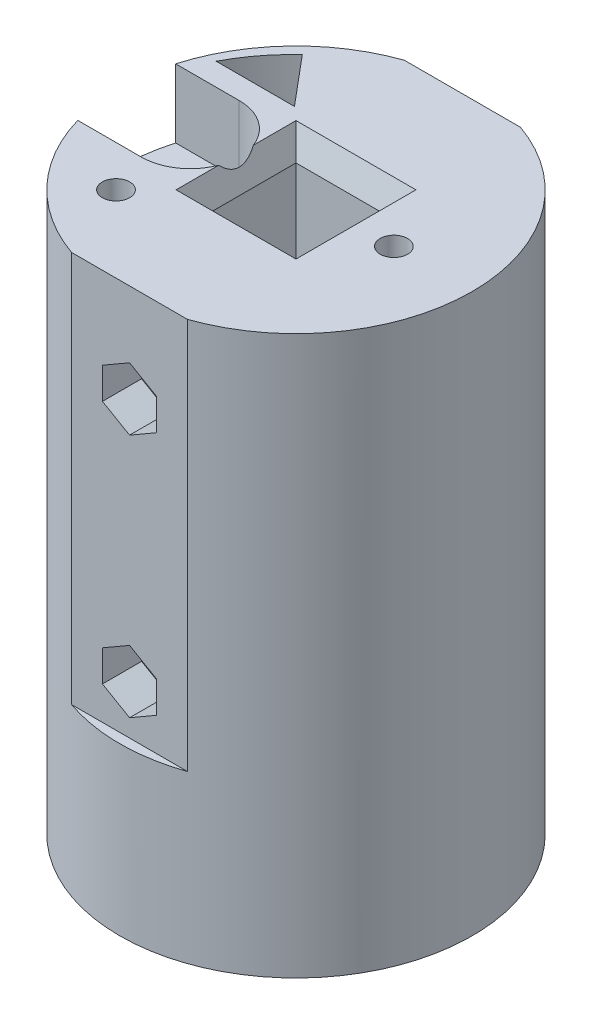
from build123d import *

# Parameters (mm, degrees)
SKETCH1_R           = 18
SKETCH1_R_2         = 2
SKETCH1_W           = 10.25
SKETCH1_H           = 10.25
BOSS_EXTRUDE1_DEPTH = 57
CUT_EXTRUDE1_START  = -7
CUT_EXTRUDE1_DEPTH  = 7
SKETCH4_W           = 9.35
SKETCH4_H           = 9.35
CUT_EXTRUDE3_DEPTH  = 20.4
CUT_EXTRUDE4_START  = -40
CUT_EXTRUDE4_DEPTH  = 40
SKETCH6_R           = 1.5
CUT_EXTRUDE5_DEPTH  = 70.267597042
SKETCH7_R           = 3
CUT_EXTRUDE6_DEPTH  = 3
CUT_EXTRUDE7_DEPTH  = 4
CHAMFER1_SIZE       = 1
CHAMFER1_SIZE_2     = 2.747477419
CUT_EXTRUDE8_DEPTH  = 63.42595614
SKETCH12_R          = 1.4
CUT_EXTRUDE10_DEPTH = 20


with BuildPart() as part:
    # Sketch1 → Boss-Extrude1 (new body)
    with BuildSketch(Plane(origin=(0, 0, 0), x_dir=(1, 0, 0), z_dir=(0, 1, 0))):
        with Locations(Location((0, 0, 0), (0, 0, 90))):
            Circle(SKETCH1_R)
        with Locations(Location((-12, 0, 0), (0, 0, 90))):
            Circle(SKETCH1_R_2, mode=Mode.SUBTRACT)
        Rectangle(SKETCH1_W, SKETCH1_H, mode=Mode.SUBTRACT)
    extrude(amount=BOSS_EXTRUDE1_DEPTH)

    # Sketch2 → Cut-Extrude1 (cut)
    with BuildSketch(Plane(origin=(0, 57, 0), x_dir=(1, 0, 0), z_dir=(0, 1, 0)).offset(CUT_EXTRUDE1_START)):
        with BuildLine():
            Line((-10.8, 5), (-17.291616466, 5))
            ThreePointArc((-17.291616466, 5), (-18, 0), (-17.291616466, -5))
            Line((-17.291616466, -5), (-10.8, -5))
            ThreePointArc((-10.8, -5), (-5.8, 0), (-10.8, 5))
        make_face()
    extrude(amount=CUT_EXTRUDE1_DEPTH, mode=Mode.SUBTRACT)

    # Sketch4 → Cut-Extrude3 (cut)
    with BuildSketch(Plane(origin=(0, 0, 0), x_dir=(-1, 0, 0), z_dir=(0, -1, 0))):
        with Locations((11.135393506, 0.872889968)):
            Rectangle(SKETCH4_W, SKETCH4_H)
    extrude(amount=-CUT_EXTRUDE3_DEPTH, mode=Mode.SUBTRACT)

    # Sketch5 → Cut-Extrude4 (cut)
    with BuildSketch(Plane(origin=(0, 57, 0), x_dir=(1, 0, 0), z_dir=(0, 1, 0)).offset(CUT_EXTRUDE4_START)):
        with BuildLine():
            Line((5.916079783, 17), (-5.916079783, 17))
            ThreePointArc((-5.916079783, 17), (0, 18), (5.916079783, 17))
        make_face()
        with BuildLine():
            Line((5.916079783, -17), (-5.916079783, -17))
            ThreePointArc((-5.916079783, -17), (0, -18), (5.916079783, -17))
        make_face()
    extrude(amount=CUT_EXTRUDE4_DEPTH, mode=Mode.SUBTRACT)

    # Sketch6 → Cut-Extrude5 (cut, through all)
    with BuildSketch(Plane(origin=(0, 0, -17), x_dir=(-1, 0, 0), z_dir=(0, 0, -1))):
        with Locations((0, 47)):
            Circle(SKETCH6_R)
        with Locations((0, 22)):
            Circle(SKETCH6_R)
    extrude(amount=-CUT_EXTRUDE5_DEPTH, mode=Mode.SUBTRACT)

    # Sketch7 → Cut-Extrude6 (cut)
    with BuildSketch(Plane(origin=(0, 0, -17), x_dir=(-1, 0, 0), z_dir=(0, 0, -1))):
        with Locations((0, 47)):
            Circle(SKETCH7_R)
        with Locations((0, 22)):
            Circle(SKETCH7_R)
    extrude(amount=-CUT_EXTRUDE6_DEPTH, mode=Mode.SUBTRACT)

    # Sketch8 → Cut-Extrude7 (cut)
    with BuildSketch(Plane.XY.offset(17)):
        Polygon((0, 43.8), (2.771281292, 45.4), (2.771281292, 48.6), (0, 50.2), (-2.771281292, 48.6), (-2.771281292, 45.4), align=None)
        Polygon((0, 18.8), (2.771281292, 20.4), (2.771281292, 23.6), (0, 25.2), (-2.771281292, 23.6), (-2.771281292, 20.4), align=None)
    extrude(amount=-CUT_EXTRUDE7_DEPTH, mode=Mode.SUBTRACT)

    # Chamfer1
    # the kernel refuses this chamfer: 2.747477419, 1 mm, written as the material it takes off along each edge
    with BuildSketch(Plane(origin=(-5.125, 57, -5.125), x_dir=(0, 0.09904090225204956, -0.9950833631817488), z_dir=(1, 0, 0)), Plane(origin=(-5.125, 57, 5.125), x_dir=(-0.9950833631817488, 0.09904090225204956, 0), z_dir=(0, 0, -1)), Plane(origin=(5.125, 57, 5.125), x_dir=(0, 0.09904090225204956, 0.9950833631817488), z_dir=(-1, 0, 0)), Plane(origin=(5.125, 57, -5.125), x_dir=(0.9950833631817488, 0.09904090225204956, 0), z_dir=(0, 0, 1))) as chamfer1_piece_1:
        Polygon((CHAMFER1_SIZE * 0.995083363182, -CHAMFER1_SIZE * 0.099040902252), (-CHAMFER1_SIZE_2 * 0.0990409022684, -CHAMFER1_SIZE_2 * 0.995083363346), (0, 0), align=None)
    extrude(amount=10.25, mode=Mode.SUBTRACT)
    with BuildSketch(Plane(origin=(-5.125, 57, 5.125), x_dir=(-0.9950833631817488, 0.09904090225204956, 0), z_dir=(0, 0, -1))) as chamfer1_piece_2a_section:
        Polygon((CHAMFER1_SIZE * 0.995083363182, -CHAMFER1_SIZE * 0.099040902252), (-CHAMFER1_SIZE_2 * 0.0990409022684, -CHAMFER1_SIZE_2 * 0.995083363346), (0, 0), align=None)
    chamfer1_piece_2a = extrude(amount=17.377491449, mode=Mode.PRIVATE)
    chamfer1_piece_2a = split(chamfer1_piece_2a, bisect_by=Plane(origin=(-5.432505006, 56.059901151, -5.125), z_dir=(0, 0, -1)), keep=Keep.TOP, mode=Mode.PRIVATE)
    with BuildSketch(Plane(origin=(-12.252491449, 57, -5.125), x_dir=(0, 0.09904090225204956, -0.9950833631817488), z_dir=(1, 0, 0))) as chamfer1_piece_2b_section:
        Polygon((CHAMFER1_SIZE * 0.995083363182, -CHAMFER1_SIZE * 0.099040902252), (-CHAMFER1_SIZE_2 * 0.0990409022684, -CHAMFER1_SIZE_2 * 0.995083363346), (0, 0), align=None)
    chamfer1_piece_2b = extrude(amount=17.377491449, mode=Mode.PRIVATE)
    chamfer1_piece_2b = split(chamfer1_piece_2b, bisect_by=Plane(origin=(-5.125, 56.059901151, -5.432505006), z_dir=(-1, 0, 0)), keep=Keep.TOP, mode=Mode.PRIVATE)
    chamfer1_piece_2 = chamfer1_piece_2a & chamfer1_piece_2b
    add(chamfer1_piece_2, mode=Mode.SUBTRACT)
    with BuildSketch(Plane(origin=(5.125, 57, -12.252491449), x_dir=(0.9950833631817488, 0.09904090225204956, 0), z_dir=(0, 0, 1))) as chamfer1_piece_3a_section:
        Polygon((CHAMFER1_SIZE * 0.995083363182, -CHAMFER1_SIZE * 0.099040902252), (-CHAMFER1_SIZE_2 * 0.0990409022684, -CHAMFER1_SIZE_2 * 0.995083363346), (0, 0), align=None)
    chamfer1_piece_3a = extrude(amount=17.377491449, mode=Mode.PRIVATE)
    chamfer1_piece_3a = split(chamfer1_piece_3a, bisect_by=Plane(origin=(5.432505006, 56.059901151, -5.125), z_dir=(0, 0, -1)), keep=Keep.TOP, mode=Mode.PRIVATE)
    with BuildSketch(Plane(origin=(-5.125, 57, -5.125), x_dir=(0, 0.09904090225204956, -0.9950833631817488), z_dir=(1, 0, 0))) as chamfer1_piece_3b_section:
        Polygon((CHAMFER1_SIZE * 0.995083363182, -CHAMFER1_SIZE * 0.099040902252), (-CHAMFER1_SIZE_2 * 0.0990409022684, -CHAMFER1_SIZE_2 * 0.995083363346), (0, 0), align=None)
    chamfer1_piece_3b = extrude(amount=17.377491449, mode=Mode.PRIVATE)
    chamfer1_piece_3b = split(chamfer1_piece_3b, bisect_by=Plane(origin=(5.125, 56.059901151, -5.432505006), z_dir=(1, 0, 0)), keep=Keep.TOP, mode=Mode.PRIVATE)
    chamfer1_piece_3 = chamfer1_piece_3a & chamfer1_piece_3b
    add(chamfer1_piece_3, mode=Mode.SUBTRACT)
    with BuildSketch(Plane(origin=(5.125, 57, 5.125), x_dir=(0, 0.09904090225204956, 0.9950833631817488), z_dir=(-1, 0, 0))) as chamfer1_piece_4a_section:
        Polygon((CHAMFER1_SIZE * 0.995083363182, -CHAMFER1_SIZE * 0.099040902252), (-CHAMFER1_SIZE_2 * 0.0990409022684, -CHAMFER1_SIZE_2 * 0.995083363346), (0, 0), align=None)
    chamfer1_piece_4a = extrude(amount=17.377491449, mode=Mode.PRIVATE)
    chamfer1_piece_4a = split(chamfer1_piece_4a, bisect_by=Plane(origin=(-5.125, 56.059901151, 5.432505006), z_dir=(-1, 0, 0)), keep=Keep.TOP, mode=Mode.PRIVATE)
    with BuildSketch(Plane(origin=(-5.125, 57, 12.252491449), x_dir=(-0.9950833631817488, 0.09904090225204956, 0), z_dir=(0, 0, -1))) as chamfer1_piece_4b_section:
        Polygon((CHAMFER1_SIZE * 0.995083363182, -CHAMFER1_SIZE * 0.099040902252), (-CHAMFER1_SIZE_2 * 0.0990409022684, -CHAMFER1_SIZE_2 * 0.995083363346), (0, 0), align=None)
    chamfer1_piece_4b = extrude(amount=17.377491449, mode=Mode.PRIVATE)
    chamfer1_piece_4b = split(chamfer1_piece_4b, bisect_by=Plane(origin=(-5.432505006, 56.059901151, 5.125), z_dir=(0, 0, 1)), keep=Keep.TOP, mode=Mode.PRIVATE)
    chamfer1_piece_4 = chamfer1_piece_4a & chamfer1_piece_4b
    add(chamfer1_piece_4, mode=Mode.SUBTRACT)
    with BuildSketch(Plane(origin=(12.252491449, 57, 5.125), x_dir=(0, 0.09904090225204956, 0.9950833631817488), z_dir=(-1, 0, 0))) as chamfer1_piece_5a_section:
        Polygon((CHAMFER1_SIZE * 0.995083363182, -CHAMFER1_SIZE * 0.099040902252), (-CHAMFER1_SIZE_2 * 0.0990409022684, -CHAMFER1_SIZE_2 * 0.995083363346), (0, 0), align=None)
    chamfer1_piece_5a = extrude(amount=17.377491449, mode=Mode.PRIVATE)
    chamfer1_piece_5a = split(chamfer1_piece_5a, bisect_by=Plane(origin=(5.125, 56.059901151, 5.432505006), z_dir=(1, 0, 0)), keep=Keep.TOP, mode=Mode.PRIVATE)
    with BuildSketch(Plane(origin=(5.125, 57, -5.125), x_dir=(0.9950833631817488, 0.09904090225204956, 0), z_dir=(0, 0, 1))) as chamfer1_piece_5b_section:
        Polygon((CHAMFER1_SIZE * 0.995083363182, -CHAMFER1_SIZE * 0.099040902252), (-CHAMFER1_SIZE_2 * 0.0990409022684, -CHAMFER1_SIZE_2 * 0.995083363346), (0, 0), align=None)
    chamfer1_piece_5b = extrude(amount=17.377491449, mode=Mode.PRIVATE)
    chamfer1_piece_5b = split(chamfer1_piece_5b, bisect_by=Plane(origin=(5.432505006, 56.059901151, 5.125), z_dir=(0, 0, 1)), keep=Keep.TOP, mode=Mode.PRIVATE)
    chamfer1_piece_5 = chamfer1_piece_5a & chamfer1_piece_5b
    add(chamfer1_piece_5, mode=Mode.SUBTRACT)

    # Sketch9 → Cut-Extrude8 (cut, through all)
    with BuildSketch(Plane.XZ):
        with BuildLine():
            Line((-7.454203172, -7.297889968), (-15.454203172, -7.297889968))
            ThreePointArc((-15.454203172, -7.297889968), (-13.761984914, -9.955415688), (-11.632322635, -12.277178848))
            Line((-11.632322635, -12.277178848), (-7.454203172, -7.297889968))
        make_face()
    extrude(amount=-CUT_EXTRUDE8_DEPTH, mode=Mode.SUBTRACT)

    # Sketch12 → Cut-Extrude10 (cut)
    with BuildSketch(Plane(origin=(0, 57, 0), x_dir=(1, 0, 0), z_dir=(0, 1, 0))):
        with Locations(Location((10, 0, 0), (0, 0, 270))):
            Circle(SKETCH12_R)
        with Locations(Location((-9.192388155, -9.192388155, 0), (0, 0, 270))):
            Circle(SKETCH12_R)
    extrude(amount=-CUT_EXTRUDE10_DEPTH, mode=Mode.SUBTRACT)


solid = part.part
